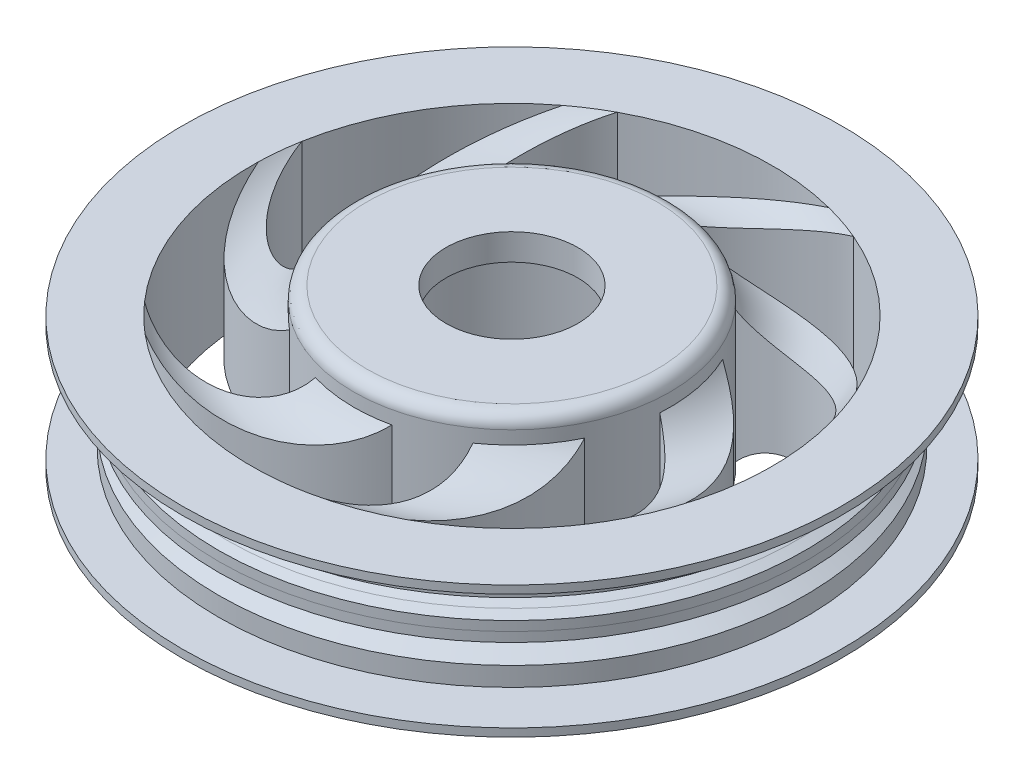
from build123d import *
from build123d.topology import SkipClean

# Parameters (mm, degrees)
SKETCH1_R           = 25
BOSS_EXTRUDE1_DEPTH = 10
SKETCH3_R           = 10
CUT_EXTRUDE1_DEPTH  = 10
BOSS_EXTRUDE2_START = 2
SKETCH4_R           = 12
SKETCH4_R_2         = 5
BOSS_EXTRUDE2_DEPTH = 2
FILLET1_R           = 1


# Read off the part's stored shape, not the designer's step: Cut-Revolve2
with BuildPart() as part:
    # Sketch1 → Boss-Extrude1 (new body)
    with BuildSketch(Plane(origin=(0, 0, 0), x_dir=(1, 0, 0), z_dir=(0, 1, 0))):
        with Locations(Location((0, 0, 0), (0, 0, 270))):
            Circle(SKETCH1_R)
    extrude(amount=BOSS_EXTRUDE1_DEPTH)

    # Cut-Revolve2 outline → Cut-Revolve2 (revolve, cut)
    with BuildSketch(Plane.XY):
        Polygon((21.001412045, 9.39), (22.251180356, 8.667910108), (22.250716321, 7.22453451), (21.000484369, 6.503248576), (21.000464035, 6.439999925), (21.625174013, 6.079055615), (22.25, 5.718312164), (22.25, 5.718044278), (22.250231953, 5.71791026), (22.25, 4.996423394), (22.25, 4.274936491), (22.249768004, 4.274802548), (22.249767961, 4.274534662), (21.624825987, 3.913992106), (21, 3.553248654), (21, 3.49), (22.25, 2.768312164), (22.25, 1.324936491), (21.011693674, 0.61), (25, 0.61), (25, 9.39), align=None)
        with BuildLine():
            Line((19.75, 10), (12, 10))
            ThreePointArc((12, 10), (15.875, 8.208435857), (19.75, 10))
        make_face()
        with BuildLine():
            Line((12.001677483, 0), (19.7429874, 0))
            ThreePointArc((19.7429874, 0), (15.872332441, 1.786460875), (12.001677483, 0))
        make_face()
    revolve(axis=Axis((0, 0, 0), (0, 1, 0)), mode=Mode.SUBTRACT)

    # Sketch3 → Cut-Extrude1 (cut)
    with BuildSketch(Plane(origin=(0, 10, 0), x_dir=(1, 0, 0), z_dir=(0, 1, 0))):
        with BuildLine():
            ThreePointArc((-11.118647469, -4.513942673), (-11.784304338, -2.26498814), (-11.999792961, 0.070490444))
            ThreePointArc((-11.999792961, 0.070490444), (-14.573025323, 7.928930726), (-11.907649277, 15.756598259))
            ThreePointArc((-11.907649277, 15.756598259), (-16.828422121, 10.337635557), (-19.43763526, 3.49869054))
            ThreePointArc((-19.43763526, 3.49869054), (-16.677126472, -1.960099894), (-11.118647469, -4.513942673))
        make_face()
        with BuildLine():
            ThreePointArc((-10.4615058, 5.878511411), (-9.118232612, 7.801143124), (-7.426636887, 9.425765993))
            ThreePointArc((-7.426636887, 9.425765993), (-2.887045007, 16.33725744), (4.894706687, 19.133853413))
            ThreePointArc((4.894706687, 19.133853413), (-2.410060641, 19.60240056), (-9.383780945, 17.378353063))
            ThreePointArc((-9.383780945, 17.378353063), (-11.930486085, 11.816600219), (-10.4615058, 5.878511411))
        make_face()
        with BuildLine():
            ThreePointArc((-1.926636887, 11.844326503), (0.414054249, 11.992854501), (2.738928238, 11.683247498))
            ThreePointArc((2.738928238, 11.683247498), (10.972939084, 12.443296082), (18.011248682, 8.102926688))
            ThreePointArc((18.011248682, 8.102926688), (13.823125658, 14.106158125), (7.736251816, 18.171761275))
            ThreePointArc((7.736251816, 18.171761275), (1.800053661, 16.695159352), (-1.926636887, 11.844326503))
        make_face()
        with BuildLine():
            ThreePointArc((8.059028897, 8.891122158), (9.634549815, 7.153701829), (10.842024536, 5.143005343))
            ThreePointArc((10.842024536, 5.143005343), (16.570076238, -0.820721023), (17.564953057, -9.029669103))
            ThreePointArc((17.564953057, -9.029669103), (19.195967322, -4.645141393), (19.75, 0))
            ThreePointArc((19.75, 0), (19.569356161, 2.665107776), (19.030729169, 5.281462611))
            ThreePointArc((19.030729169, 5.281462611), (14.175116286, 9.001922974), (8.059028897, 8.891122158))
        make_face()
        with BuildLine():
            ThreePointArc((15.994679301, -11.585885121), (15.876027228, -5.469945009), (11.976081548, -0.757278518))
            ThreePointArc((11.976081548, -0.757278518), (11.600032861, -3.072334229), (10.780855221, -5.270024734))
            ThreePointArc((10.780855221, -5.270024734), (9.689608016, -13.466718458), (3.89188952, -19.362739888))
            ThreePointArc((3.89188952, -19.362739888), (10.676552458, -16.615466518), (15.994679301, -11.585885121))
        make_face()
        with BuildLine():
            ThreePointArc((0.914309688, -19.728825048), (5.621965855, -15.822832834), (6.874900525, -9.835433024))
            ThreePointArc((6.874900525, -9.835433024), (4.830454566, -10.984839948), (2.601482036, -11.714618697))
            ThreePointArc((2.601482036, -11.714618697), (-4.487332674, -15.972002223), (-12.711846205, -15.115272609))
            ThreePointArc((-12.711846205, -15.115272609), (-6.333773243, -18.706838763), (0.914309688, -19.728825048))
        make_face()
        with BuildLine():
            ThreePointArc((-14.854553769, -13.015557319), (-8.865550474, -14.260804807), (-3.403220815, -11.507305857))
            ThreePointArc((-3.403220815, -11.507305857), (-5.576554541, -10.625537137), (-7.536860184, -9.337865847))
            ThreePointArc((-7.536860184, -9.337865847), (-15.285220335, -6.450042545), (-19.743302464, 0.51430324))
            ThreePointArc((-19.743302464, 0.51430324), (-18.574638507, -6.711579869), (-14.854553769, -13.015557319))
        make_face()
        with Locations(Location((0, 0, 0), (0, 0, 270))):
            Circle(SKETCH3_R)
    extrude(amount=-CUT_EXTRUDE1_DEPTH, mode=Mode.SUBTRACT)

    # Sketch4 → Boss-Extrude2 (add)
    with SkipClean():  # the faces are left unmerged after this step: merging them gives an invalid solid
        with BuildSketch(Plane(origin=(0, 10, 0), x_dir=(1, 0, 0), z_dir=(0, 1, 0)).offset(BOSS_EXTRUDE2_START)):
            with Locations(Location((0, 0, 0), (0, 0, 270))):
                Circle(SKETCH4_R)
            with Locations(Location((0, 0, 0), (0, 0, 270))):
                Circle(SKETCH4_R_2, mode=Mode.SUBTRACT)
        extrude(amount=-BOSS_EXTRUDE2_DEPTH)

    # Fillet1
    fillet1_edges = [part.edges().sort_by_distance(p)[0] for p in [
        (0, 12, -12),
    ]]
    fillet(fillet1_edges, radius=FILLET1_R)


solid = part.part
